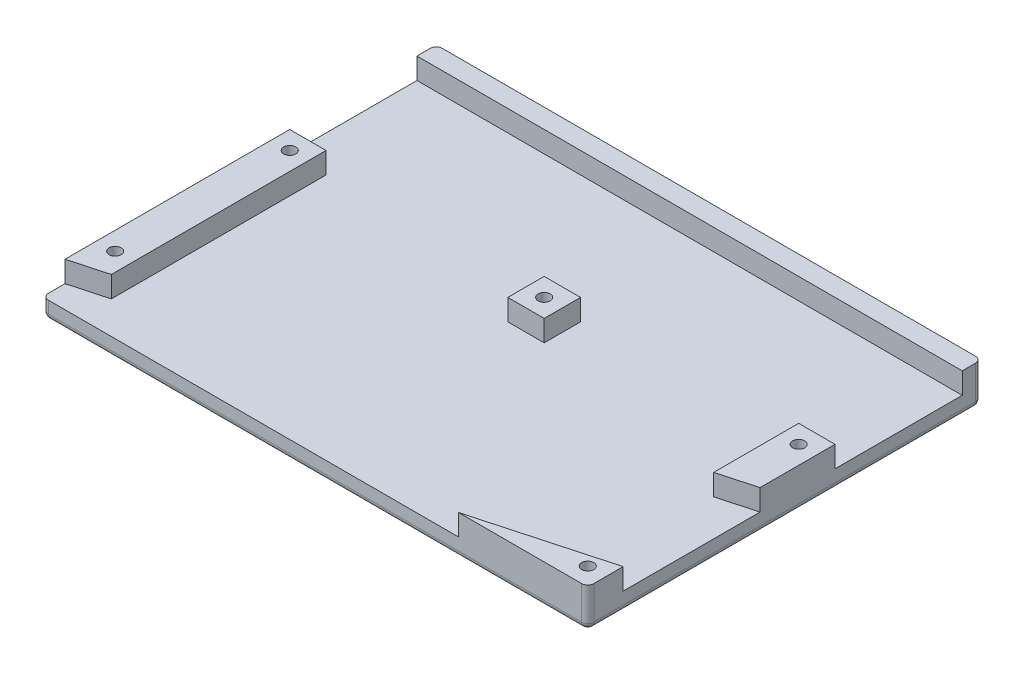
from build123d import *

# Parameters (mm, degrees)
SKETCH1_W           = 90
SKETCH1_H           = 65
BOSS_EXTRUDE1_DEPTH = 3
SKETCH2_W           = 90
SKETCH2_H           = 3.187087834
SKETCH2_W_2         = 6
SKETCH2_H_2         = 6
BOSS_EXTRUDE2_DEPTH = 3.5
SKETCH3_R           = 1
CUT_EXTRUDE1_DEPTH  = 14.5
FILLET1_R           = 1
FILLET2_R           = 1


with BuildPart() as part:
    # Sketch1 → Boss-Extrude1 (new body)
    with BuildSketch(Plane(origin=(0, 0, 0), x_dir=(1, 0, 0), z_dir=(0, 1, 0))):
        with Locations((45, 32.5)):
            Rectangle(SKETCH1_W, SKETCH1_H)
    extrude(amount=BOSS_EXTRUDE1_DEPTH)

    # Sketch2 → Boss-Extrude2 (add)
    with BuildSketch(Plane(origin=(0, 3, 0), x_dir=(1, 0, 0), z_dir=(0, 1, 0))):
        with Locations((45, 63.406456083)):
            Rectangle(SKETCH2_W, SKETCH2_H)
        Polygon((0, 40.812912166), (6, 40.812912166), (6, 5.373702529), (4, 4.824577906), (0, 3.72632866), align=None)
        Polygon((90, 40.812912166), (84, 40.812912166), (84, 26.789562822), (86, 27.338687445), (90, 28.436936691), align=None)
        with Locations((45, 37.812912166)):
            Rectangle(SKETCH2_W_2, SKETCH2_H_2)
        Polygon((68.697463874, 0), (90, 5.848873559), (90, 0), align=None)
    extrude(amount=BOSS_EXTRUDE2_DEPTH)

    # Sketch3 → Cut-Extrude1 (cut)
    with BuildSketch(Plane(origin=(0, 6.5, 0), x_dir=(1, 0, 0), z_dir=(0, 1, 0))):
        with Locations(Location((45, 37.812912166, 0), (0, 0, 270))):
            Circle(SKETCH3_R)
        with Locations(Location((3, 37.812912166, 0), (0, 0, 270))):
            Circle(SKETCH3_R)
        with Locations(Location((3, 9, 0), (0, 0, 270))):
            Circle(SKETCH3_R)
        with Locations(Location((87, 37.812912166, 0), (0, 0, 270))):
            Circle(SKETCH3_R)
        with Locations(Location((87, 3, 0), (0, 0, 270))):
            Circle(SKETCH3_R)
    extrude(amount=-CUT_EXTRUDE1_DEPTH, mode=Mode.SUBTRACT)

    # Fillet1
    fillet1_edges = [part.edges().sort_by_distance(p)[0] for p in [
        (45, 0, -65),
        (90, 0, -32.5),
        (45, 0, 0),
        (0, 0, -32.5),
    ]]
    fillet(fillet1_edges, radius=FILLET1_R)

    # Fillet2
    # the kernel refuses this fillet: 1 mm, written as the material it takes off along each edge
    with BuildSketch(Plane(origin=(89, 1, -1), x_dir=(1, 0, 0), z_dir=(0, 0, 1))) as fillet2_piece_1_section:
        Polygon((0, 0), (FILLET2_R, 0), (FILLET2_R, -FILLET2_R), (0, -FILLET2_R), align=None)
    fillet2_piece_1 = extrude(amount=FILLET2_R, mode=Mode.PRIVATE)
    fillet2_piece_1 = fillet2_piece_1 - Plane(origin=(89, 1, -1), x_dir=(-0.7071067811865475, 0.7071067811865475, 0), z_dir=(0, 0, 1)) * Sphere(FILLET2_R, mode=Mode.PRIVATE)
    add(fillet2_piece_1, mode=Mode.SUBTRACT)
    with BuildSketch(Plane(origin=(1, 1, -1), x_dir=(-1, 0, 0), z_dir=(0, 0, 1))) as fillet2_piece_2_section:
        Polygon((0, 0), (FILLET2_R, 0), (FILLET2_R, FILLET2_R), (0, FILLET2_R), align=None)
    fillet2_piece_2 = extrude(amount=FILLET2_R, mode=Mode.PRIVATE)
    fillet2_piece_2 = fillet2_piece_2 - Plane(origin=(1, 1, -1), x_dir=(0.7071067811865475, 0.7071067811865475, 0), z_dir=(0, 0, 1)) * Sphere(FILLET2_R, mode=Mode.PRIVATE)
    add(fillet2_piece_2, mode=Mode.SUBTRACT)
    with BuildSketch(Plane(origin=(89, 1, -64), x_dir=(0, 0, -1), z_dir=(1, 0, 0))) as fillet2_piece_3_section:
        Polygon((0, 0), (FILLET2_R, 0), (FILLET2_R, -FILLET2_R), (0, -FILLET2_R), align=None)
    fillet2_piece_3 = extrude(amount=FILLET2_R, mode=Mode.PRIVATE)
    fillet2_piece_3 = fillet2_piece_3 - Plane(origin=(89, 1, -64), x_dir=(0, 0.7071067811865475, 0.7071067811865475), z_dir=(1, 0, 0)) * Sphere(FILLET2_R, mode=Mode.PRIVATE)
    add(fillet2_piece_3, mode=Mode.SUBTRACT)
    with BuildSketch(Plane(origin=(1, 1, -64), x_dir=(0, 0, -1), z_dir=(-1, 0, 0))) as fillet2_piece_4_section:
        Polygon((0, 0), (FILLET2_R, 0), (FILLET2_R, FILLET2_R), (0, FILLET2_R), align=None)
    fillet2_piece_4 = extrude(amount=FILLET2_R, mode=Mode.PRIVATE)
    fillet2_piece_4 = fillet2_piece_4 - Plane(origin=(1, 1, -64), x_dir=(0, 0.7071067811865475, 0.7071067811865475), z_dir=(-1, 0, 0)) * Sphere(FILLET2_R, mode=Mode.PRIVATE)
    add(fillet2_piece_4, mode=Mode.SUBTRACT)
    with BuildSketch(Plane(origin=(0, 9, -65), x_dir=(0, 0, 1), z_dir=(0, -1, 0)), Plane(origin=(90, 1, -65), x_dir=(0, 0, 1), z_dir=(0, 1, 0))) as fillet2_piece_5:
        with BuildLine():
            CenterArc((FILLET2_R, -FILLET2_R), FILLET2_R, 90, 90)
            Line((0, -FILLET2_R), (0, 0))
            Line((0, 0), (FILLET2_R, 0))
        make_face()
    extrude(amount=8, mode=Mode.SUBTRACT)
    with BuildSketch(Plane(origin=(90, 3, 0), x_dir=(-1.5916157280951914e-11, 0, -1.0), z_dir=(0, 1, 0))) as fillet2_piece_6:
        with BuildLine():
            CenterArc((FILLET2_R, FILLET2_R), FILLET2_R, 179.999999999, 90)
            Line((0, FILLET2_R), (0, 0))
            Line((0, 0), (FILLET2_R, 0))
        make_face()
    extrude(amount=6, mode=Mode.SUBTRACT)
    with BuildSketch(Plane(origin=(0, 1, 0), x_dir=(1, 0, 0), z_dir=(0, 1, 0))) as fillet2_piece_7:
        with BuildLine():
            CenterArc((FILLET2_R, FILLET2_R), FILLET2_R, 180, 90)
            Line((0, FILLET2_R), (0, 0))
            Line((0, 0), (FILLET2_R, 0))
        make_face()
    extrude(amount=4.5, mode=Mode.SUBTRACT)
    with BuildSketch(Plane(origin=(90, 1, 0), x_dir=(-1, 0, 0), z_dir=(0, 1, 0))) as fillet2_piece_8:
        with BuildLine():
            CenterArc((FILLET2_R, -FILLET2_R), FILLET2_R, 90, 90)
            Line((0, -FILLET2_R), (0, 0))
            Line((0, 0), (FILLET2_R, 0))
        make_face()
    extrude(amount=2, mode=Mode.SUBTRACT)


solid = part.part
